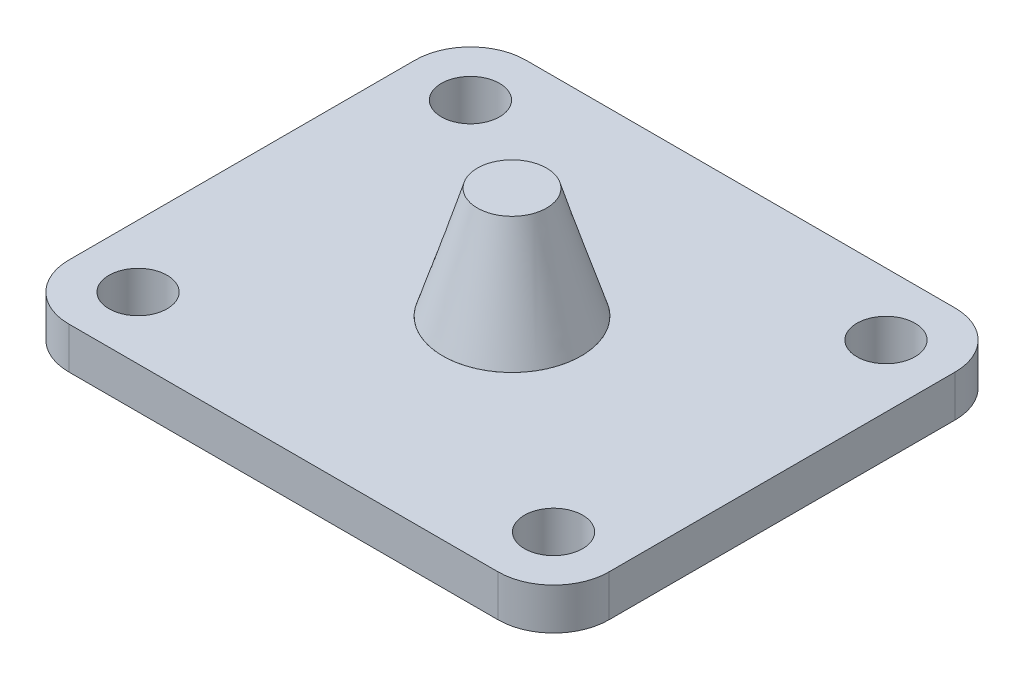
from build123d import *

# Parameters (mm, degrees)
SKETCH_1_W          = 39
SKETCH_1_H          = 33
SKETCH_1_R          = 2.1
EXTRUDE_1_DEPTH     = 3
FILLET_1_R          = 4
SKETCH_2_R          = 5
CUT_EXTRUDE_1_DEPTH = 3


with BuildPart() as part:
    # 草图1 → 凸台-拉伸1 (new body)
    with BuildSketch(Plane(origin=(0, 0, 0), x_dir=(1, 0, 0), z_dir=(0, 1, 0))):
        with Locations((19.5, 16.5)):
            Rectangle(SKETCH_1_W, SKETCH_1_H)
        with Locations(Location((4.5, 28.5, 0), (0, 0, 270))):
            Circle(SKETCH_1_R, mode=Mode.SUBTRACT)
        with Locations(Location((34.5, 28.5, 0), (0, 0, 270))):
            Circle(SKETCH_1_R, mode=Mode.SUBTRACT)
        with Locations(Location((34.5, 4.5, 0), (0, 0, 270))):
            Circle(SKETCH_1_R, mode=Mode.SUBTRACT)
        with Locations(Location((4.5, 4.5, 0), (0, 0, 270))):
            Circle(SKETCH_1_R, mode=Mode.SUBTRACT)
    extrude(amount=EXTRUDE_1_DEPTH)

    # 圆角1
    fillet_1_edges = [part.edges().sort_by_distance(p)[0] for p in [
        (0, 1.5, -33),
        (39, 1.5, -33),
        (39, 1.5, 0),
        (0, 1.5, 0),
    ]]
    fillet(fillet_1_edges, radius=FILLET_1_R)

    # 草图2 → 切除-拉伸1 (cut)
    with BuildSketch(Plane(origin=(0, 3, 0), x_dir=(1, 0, 0), z_dir=(0, 1, 0))):
        with Locations(Location((19.5, 16.5, 0), (0, 0, 270))):
            Circle(SKETCH_2_R)
    extrude(amount=-CUT_EXTRUDE_1_DEPTH, mode=Mode.SUBTRACT)


with BuildPart() as body_2:
    # 放样1: read off the stored shape, not the designer's step
    # 放样1: loft between two sections, ruled curve by curve
    loft_1_from = [
        Edge.make_bspline([(23.79408437, 3, -13.938586441), (28.916911488, 3, -22.526755182), (20.328742747, 3, -27.6495823), (15.20591563, 3, -19.061413559), (10.083088512, 3, -10.473244818), (18.671257253, 3, -5.3504177), (23.79408437, 3, -13.938586441)], [0, 0, 0, 0, 0.5, 0.5, 0.5, 1, 1, 1, 1], 3, [1, 0.333333333, 0.333333333, 1, 0.333333333, 0.333333333, 1]),
    ]
    loft_1_to = [
        Edge.make_bspline([(21.887161362, 11, -15.757396046), (23.37236927, 11, -20.53171877), (18.598046546, 11, -22.016926678), (17.112838638, 11, -17.242603954), (15.62763073, 11, -12.46828123), (20.401953454, 11, -10.983073322), (21.887161362, 11, -15.757396046)], [0, 0, 0, 0, 0.5, 0.5, 0.5, 1, 1, 1, 1], 3, [1, 0.333333333, 0.333333333, 1, 0.333333333, 0.333333333, 1]),
    ]
    loft_1 = Solid(Shell([*[Face.make_surface_from_curves(loft_1_from[k], loft_1_to[k]) for k in range(1)], Face(Wire(loft_1_from)), Face(Wire(loft_1_to))]))
    add(loft_1)


solid = Compound([part.part, body_2.part])
